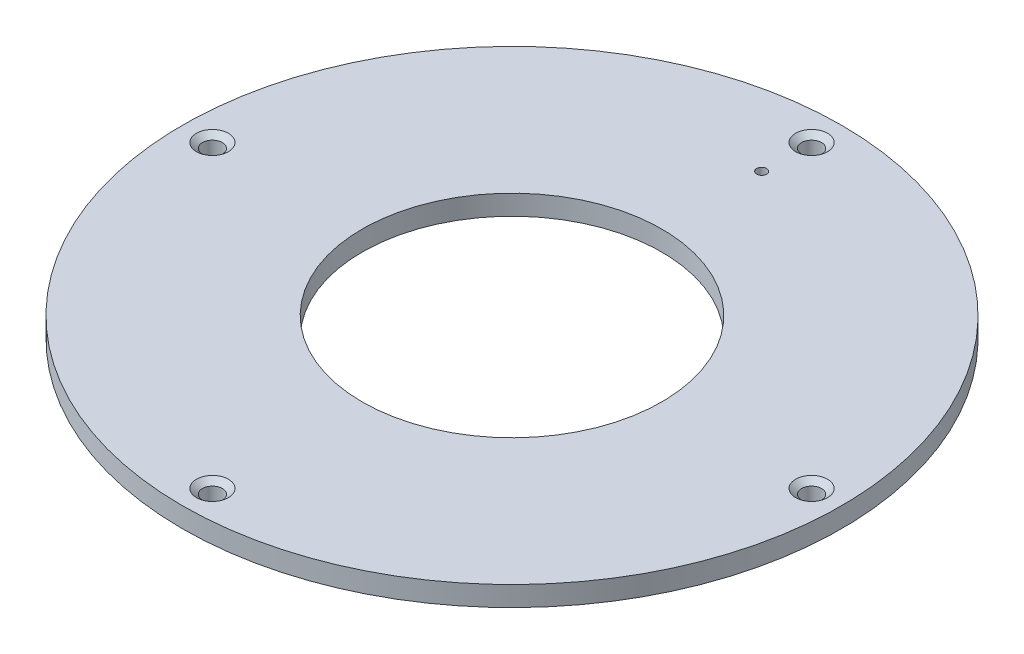
from build123d import *

# Parameters (mm, degrees)
SKETCH1_R                                       = 16.5
BOSS_EXTRUDE1_DEPTH                             = 1
CUT_EXTRUDE1_DEPTH                              = 24.355941428
CUT_EXTRUDE1_DEPTH_BACK                         = 24.355941428
SKETCH2_R                                       = 7.5
CUT_EXTRUDE2_DEPTH                              = 24.355941428
CUT_EXTRUDE2_DEPTH_BACK                         = 24.355941428
SKETCH4_R                                       = 0.25
CSK_FOR_M2_FLAT_HEAD_MACHINE_SCREW1_D           = 1
CSK_FOR_M2_FLAT_HEAD_MACHINE_SCREW1_CSINK_D     = 1.6
CSK_FOR_M2_FLAT_HEAD_MACHINE_SCREW1_CSINK_ANGLE = 100


with BuildPart() as part:
    # Sketch1 → Boss-Extrude1 (new body)
    with BuildSketch(Plane(origin=(0, 0, 0), x_dir=(1, 0, 0), z_dir=(0, 1, 0))):
        Circle(SKETCH1_R)
    extrude(amount=BOSS_EXTRUDE1_DEPTH)

    # Sketch2 → Cut-Extrude1 (cut, two sides: drawn at the far end of the back side and taken through both)
    with BuildSketch(Plane(origin=(0, 1, 0), x_dir=(1, 0, 0), z_dir=(0, 1, 0)).offset(-CUT_EXTRUDE1_DEPTH_BACK)):
        Circle(SKETCH2_R)
    extrude(amount=CUT_EXTRUDE1_DEPTH + CUT_EXTRUDE1_DEPTH_BACK, mode=Mode.SUBTRACT)

    # Sketch4 → Cut-Extrude2 (cut, two sides: drawn at the far end of the back side and taken through both)
    with BuildSketch(Plane(origin=(0, 1, 0), x_dir=(1, 0, 0), z_dir=(0, 1, 0)).offset(-CUT_EXTRUDE2_DEPTH_BACK)):
        with Locations((0, 12.5)):
            Circle(SKETCH4_R)
    extrude(amount=CUT_EXTRUDE2_DEPTH + CUT_EXTRUDE2_DEPTH_BACK, mode=Mode.SUBTRACT)

    # CSK for M2 Flat Head Machine Screw1 (through all)
    with Locations(Plane(origin=(0, 1, 0), x_dir=(1, 0, 0), z_dir=(0, 1, 0))):
        with Locations((0, 15), (15, 0), (0, -15), (-15, 0)):
            CounterSinkHole(CSK_FOR_M2_FLAT_HEAD_MACHINE_SCREW1_D / 2, CSK_FOR_M2_FLAT_HEAD_MACHINE_SCREW1_CSINK_D / 2, counter_sink_angle=CSK_FOR_M2_FLAT_HEAD_MACHINE_SCREW1_CSINK_ANGLE)


solid = part.part
